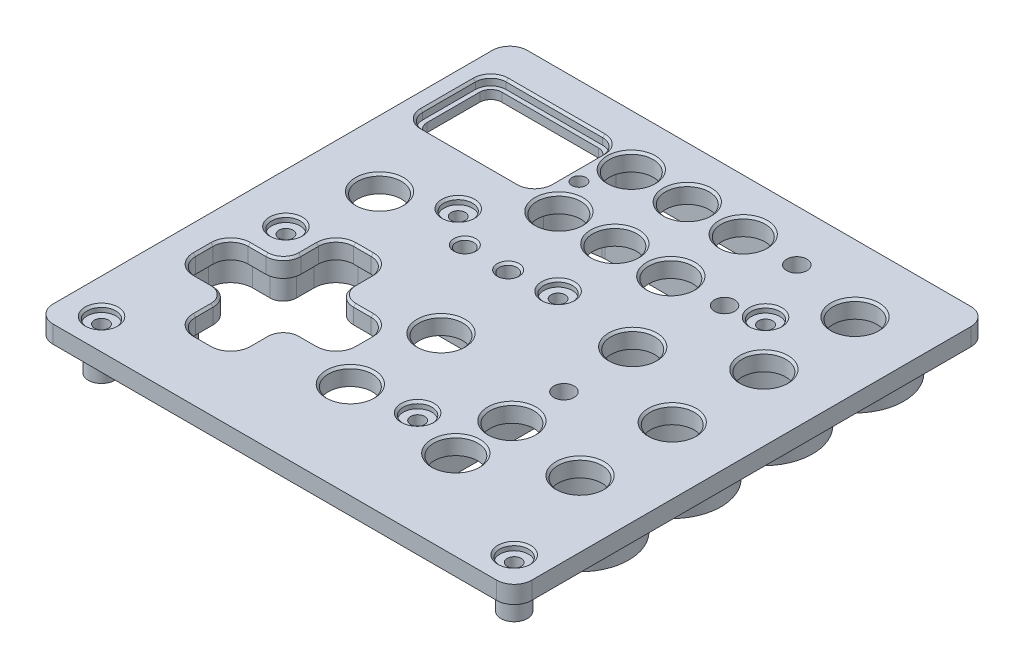
from build123d import *

# Parameters (mm, degrees)
BOSS_EXTRUDE1_DEPTH = 4
SKETCH3_R           = 5
SKETCH3_R_2         = 2
SKETCH3_R_3         = 2.3
CUT_EXTRUDE2_DEPTH  = 149.830769596
CUT_EXTRUDE8_DEPTH  = 2
CUT_EXTRUDE9_DEPTH  = 149.79044989
SKETCH13_R          = 10
SKETCH13_R_2        = 10.000000001
BOSS_EXTRUDE2_DEPTH = 7.1
CUT_EXTRUDE10_DEPTH = 1.5
SKETCH8_R           = 1.6
CUT_EXTRUDE7_DEPTH  = 150.190509009
FILLET1_R           = 4
FILLET2_R           = 4
FILLET5_R           = 4
SKETCH15_R          = 3.25
CUT_EXTRUDE11_DEPTH = 1.5
CHAMFER1_SIZE       = 0.5
FILLET10_R          = 3
SKETCH16_R          = 3
BOSS_EXTRUDE4_DEPTH = 7.1
SKETCH17_R          = 1.6
CUT_EXTRUDE12_DEPTH = 149.946325966
FILLET13_R          = 2


with BuildPart() as part:
    # Sketch1 → Boss-Extrude1 (new body)
    with BuildSketch(Plane(origin=(0, 0, 0), x_dir=(1, 0, 0), z_dir=(0, 1, 0))):
        with BuildLine():
            Line((32.631203293, 56.499998748), (133.631203293, 56.499998748))
            ThreePointArc((133.631203293, 56.499998748), (136.459630418, 55.328425873), (137.631203293, 52.499998748))
            Line((137.631203293, 52.499998748), (137.631203293, -47.500001252))
            ThreePointArc((137.631203293, -47.500001252), (136.459630418, -50.328428376), (133.631203293, -51.500001252))
            Line((133.631203293, -51.500001252), (32.631198922, -51.500001252))
            ThreePointArc((32.631198922, -51.500001252), (29.802771735, -50.328428314), (28.631198922, -47.500001077))
            Line((28.631198922, -47.500001077), (28.631203293, 52.499998923))
            ThreePointArc((28.631203293, 52.499998923), (29.80277623, 55.328425935), (32.631203293, 56.499998748))
        make_face()
    extrude(amount=BOSS_EXTRUDE1_DEPTH)

    # Sketch3 → Cut-Extrude2 (cut, through all)
    with BuildSketch(Plane(origin=(0, 4, 0), x_dir=(1, 0, 0), z_dir=(0, 1, 0))):
        with Locations(Location((122.506077718, 41.249953743, 0), (0, 0, 270))):
            Circle(SKETCH3_R)
        with Locations(Location((122.506076811, 20.499953743, 0), (0, 0, 270))):
            Circle(SKETCH3_R)
        with Locations(Location((122.506075899, -0.375046257, 0), (0, 0, 270))):
            Circle(SKETCH3_R)
        with Locations(Location((122.506074981, -21.375046257, 0), (0, 0, 270))):
            Circle(SKETCH3_R)
        with Locations(Location((103.95608732, -18.35004392, 0), (0, 0, 270))):
            Circle(SKETCH3_R)
        with Locations(Location((103.131076352, 9.99995459, 0), (0, 0, 270))):
            Circle(SKETCH3_R)
        with Locations(Location((78.581080094, -9.125044337, 0), (0, 0, 270))):
            Circle(SKETCH3_R)
        with Locations(Location((78.306321818, -29.499964216, 0), (0, 0, 270))):
            Circle(SKETCH3_R)
        with Locations(Location((43.631236649, 11.824870216, 0), (0, 0, 270))):
            Circle(SKETCH3_R)
        with Locations(Location((68.006161076, 28.300119395, 0), (0, 0, 270))):
            Circle(SKETCH3_R)
        with Locations(Location((80.756161076, 28.300118837, 0), (0, 0, 270))):
            Circle(SKETCH3_R)
        with Locations(Location((93.506168705, 28.30011828, 0), (0, 0, 270))):
            Circle(SKETCH3_R)
        with Locations(Location((93.506154167, 44.800125909, 0), (0, 0, 270))):
            Circle(SKETCH3_R)
        with Locations(Location((80.756161797, 44.800118837, 0), (0, 0, 270))):
            Circle(SKETCH3_R)
        with Locations(Location((68.006161797, 44.800119395, 0), (0, 0, 270))):
            Circle(SKETCH3_R)
        with Locations(Location((103.956071503, -31.125045446, 0), (0, 0, 270))):
            Circle(SKETCH3_R)
        with Locations(Location((63.881160319, 11.000124153, 0), (0, 0, 270))):
            Circle(SKETCH3_R_2)
        with Locations(Location((73.756244243, 10.999871951, 0), (0, 0, 270))):
            Circle(SKETCH3_R_2)
        with Locations(Location((105.634355846, 44.874916397, 0), (0, 0, 270))):
            Circle(SKETCH3_R_3)
        with Locations(Location((105.414739927, 28.624916408, 0), (0, 0, 270))):
            Circle(SKETCH3_R_3)
        with Locations(Location((104.131289505, -6.67345448, 0), (0, 0, 270))):
            Circle(SKETCH3_R_3)
        with BuildLine():
            Line((50.995103356, -1.449879142), (54.995103356, -1.449879142))
            ThreePointArc((54.995103356, -1.449879142), (57.82353048, -2.621452017), (58.995103356, -5.449879142))
            Line((58.995103356, -5.449879142), (58.995103356, -9.449879142))
            ThreePointArc((58.995103356, -9.449879142), (60.166676231, -12.278306267), (62.995103356, -13.449879142))
            Line((62.995103356, -13.449879142), (66.995103356, -13.449879142))
            ThreePointArc((66.995103356, -13.449879142), (69.82353048, -14.621452017), (70.995103356, -17.449879142))
            Line((70.995103356, -17.449879142), (70.995103356, -21.449879142))
            ThreePointArc((70.995103356, -21.449879142), (69.82353048, -24.278306267), (66.995103356, -25.449879142))
            Line((66.995103356, -25.449879142), (62.995103356, -25.449879142))
            ThreePointArc((62.995103356, -25.449879142), (60.166676231, -26.621452017), (58.995103356, -29.449879142))
            Line((58.995103356, -29.449879142), (58.995103356, -33.449879142))
            ThreePointArc((58.995103356, -33.449879142), (57.82353048, -36.278306267), (54.995103356, -37.449879142))
            Line((54.995103356, -37.449879142), (50.995103356, -37.449879142))
            ThreePointArc((50.995103356, -37.449879142), (48.166676231, -36.278306267), (46.995103356, -33.449879142))
            Line((46.995103356, -33.449879142), (46.995103356, -29.449879142))
            ThreePointArc((46.995103356, -29.449879142), (45.82353048, -26.621452017), (42.995103356, -25.449879142))
            Line((42.995103356, -25.449879142), (38.995103356, -25.449879142))
            ThreePointArc((38.995103356, -25.449879142), (36.166676231, -24.278306267), (34.995103356, -21.449879142))
            Line((34.995103356, -21.449879142), (34.995103356, -17.449879142))
            ThreePointArc((34.995103356, -17.449879142), (36.166676231, -14.621452017), (38.995103356, -13.449879142))
            Line((38.995103356, -13.449879142), (42.995103356, -13.449879142))
            ThreePointArc((42.995103356, -13.449879142), (45.82353048, -12.278306267), (46.995103356, -9.449879142))
            Line((46.995103356, -9.449879142), (46.995103356, -5.449879142))
            ThreePointArc((46.995103356, -5.449879142), (48.166676231, -2.621452017), (50.995103356, -1.449879142))
        make_face()
    extrude(amount=-CUT_EXTRUDE2_DEPTH, mode=Mode.SUBTRACT)

    # Sketch11 → Cut-Extrude8 (cut)
    with BuildSketch(Plane(origin=(0, 4, 0), x_dir=(1, 0, 0), z_dir=(0, 1, 0))):
        with BuildLine():
            Line((61.435461836, 44.861496233), (61.435461312, 32.861496233))
            ThreePointArc((61.435461312, 32.861496233), (60.410334938, 30.386622544), (57.935461159, 29.361496386))
            Line((57.935461159, 29.361496386), (35.935461159, 29.361497348))
            ThreePointArc((35.935461159, 29.361497348), (33.460587469, 30.386623722), (32.435461312, 32.861497501))
            Line((32.435461312, 32.861497501), (32.435461836, 44.861497501))
            ThreePointArc((32.435461836, 44.861497501), (33.46058821, 47.33637119), (35.935461989, 48.361497348))
            Line((35.935461989, 48.361497348), (57.935461989, 48.361496386))
            ThreePointArc((57.935461989, 48.361496386), (60.410335678, 47.336370012), (61.435461836, 44.861496233))
        make_face()
    extrude(amount=-CUT_EXTRUDE8_DEPTH, mode=Mode.SUBTRACT)

    # Sketch12 → Cut-Extrude9 (cut, through all)
    with BuildSketch(Plane(origin=(0, 2, 0), x_dir=(1, 0, 0), z_dir=(0, 1, 0))):
        with BuildLine():
            Line((57.935461945, 47.361496386), (35.935461945, 47.361497348))
            ThreePointArc((35.935461945, 47.361497348), (34.16769496, 46.629264378), (33.435461836, 44.861497457))
            Line((33.435461836, 44.861497457), (33.435461312, 32.861497457))
            ThreePointArc((33.435461312, 32.861497457), (34.167694281, 31.093730472), (35.935461202, 30.361497348))
            Line((35.935461202, 30.361497348), (57.935461202, 30.361496386))
            ThreePointArc((57.935461202, 30.361496386), (59.703228187, 31.093729356), (60.435461312, 32.861496277))
            Line((60.435461312, 32.861496277), (60.435461836, 44.861496277))
            ThreePointArc((60.435461836, 44.861496277), (59.703228866, 46.629263262), (57.935461945, 47.361496386))
        make_face()
    extrude(amount=-CUT_EXTRUDE9_DEPTH, mode=Mode.SUBTRACT)

    # Sketch13 → Boss-Extrude2 (add)
    # profile 1 of 2: a face of its own
    with BuildSketch(Plane.XZ):
        with BuildLine():
            Line((112.381311503, -52.499998748), (112.381311503, -45.832521393))
            ThreePointArc((112.381311503, -45.832521393), (128.710531391, -50.456591469), (130.601426663, -33.590947062))
            ThreePointArc((130.601426663, -33.590947062), (129.512041425, -30.847168509), (130.601426423, -28.103389861))
            ThreePointArc((130.601426423, -28.103389861), (133.631268001, -20.44050639), (130.557858117, -12.794993014))
            ThreePointArc((130.557858117, -12.794993014), (129.452808289, -10.034669017), (130.557889384, -7.274357538))
            ThreePointArc((130.557889384, -7.274357538), (133.631472718, 0.435028029), (130.513728685, 8.126660657))
            ThreePointArc((130.513728685, 8.126660657), (129.392770218, 10.903491507), (130.513646115, 13.680355688))
            ThreePointArc((130.513646115, 13.680355688), (129.265062352, 30.239913396), (112.956076474, 27.11023409))
            Line((112.956076474, 27.11023409), (112.956071503, 31.125045446))
            ThreePointArc((112.956071503, 31.125045446), (103.956071503, 40.125045446), (94.956071503, 31.125045446))
            Line((94.956071503, 31.125045446), (94.956102156, 6.367721726))
            ThreePointArc((94.956102156, 6.367721726), (95.194943617, 4.308088057), (95.898790175, 2.35777113))
            ThreePointArc((95.898790175, 2.35777113), (96.269036168, -0.046874941), (95.177457934, -2.221239625))
            ThreePointArc((95.177457934, -2.221239625), (92.815567647, -5.833573353), (92.006188808, -10.072958519))
            Line((92.006188808, -10.072958519), (92.006188808, -16.499953743))
            ThreePointArc((92.006188808, -16.499953743), (90.834615932, -19.328380868), (88.006188808, -20.499953743))
            Line((88.006188808, -20.499953743), (61.381311503, -20.499953743))
            Line((61.381311503, -20.499953743), (61.381311503, -21.499998748))
            Line((61.381311503, -21.499998748), (61.381311503, -52.499998748))
            Line((61.381311503, -52.499998748), (112.381311503, -52.499998748))
        make_face()
        with Locations(Location((122.506077718, -41.249953743, 0), (0, 0, 270))):
            Circle(SKETCH13_R, mode=Mode.SUBTRACT)
        with Locations(Location((122.50607681, -20.499953743, 0), (0, 0, 270))):
            Circle(SKETCH13_R_2, mode=Mode.SUBTRACT)
        with Locations(Location((122.506075865, 0.403127197, 0), (0, 0, 270))):
            Circle(SKETCH13_R, mode=Mode.SUBTRACT)
        with Locations(Location((103.131076352, -9.99995459, 0), (0, 0, 270))):
            Circle(SKETCH13_R, mode=Mode.SUBTRACT)
        with Locations(Location((122.506074981, 21.375046257, 0), (0, 0, 270))):
            Circle(SKETCH13_R, mode=Mode.SUBTRACT)
        with BuildLine():
            Line((68.006161076, -22.300121067), (106.506161076, -22.300121067))
            ThreePointArc((106.506161076, -22.300121067), (109.3345882, -23.471693942), (110.506161076, -26.300121067))
            Line((110.506161076, -26.300121067), (110.506161076, -34.300117723))
            Line((110.506161076, -34.300117723), (110.506161076, -35.300117723))
            Line((110.506161076, -35.300117723), (71.525951312, -35.300117723))
            ThreePointArc((71.525951312, -35.300117723), (71.217230855, -35.288186388), (70.910352122, -35.252463562))
            Line((70.910352122, -35.252463562), (68.271969785, -34.841521277))
            ThreePointArc((68.271969785, -34.841521277), (68.036326851, -34.811953853), (67.799344527, -34.796423127))
            ThreePointArc((67.799344527, -34.796423127), (64.366254104, -33.511828549), (62.393936762, -30.42212672))
            ThreePointArc((62.393936762, -30.42212672), (63.069968172, -24.889259496), (68.006161076, -22.300121067))
        make_face(mode=Mode.SUBTRACT)
        with BuildLine():
            Line((68.006161797, -51.300119395), (106.506161076, -51.300119395))
            ThreePointArc((106.506161076, -51.300119395), (109.3345882, -50.128546519), (110.506161076, -47.300119395))
            Line((110.506161076, -47.300119395), (110.506161076, -42.800119395))
            ThreePointArc((110.506161076, -42.800119395), (109.3345882, -39.97169227), (106.506161076, -38.800119395))
            Line((106.506161076, -38.800119395), (68.006161797, -38.800119395))
            ThreePointArc((68.006161797, -38.800119395), (63.069967049, -41.389257126), (62.393934992, -46.92212559))
            ThreePointArc((62.393934992, -46.92212559), (64.447232202, -50.076170733), (68.006161797, -51.300119395))
        make_face(mode=Mode.SUBTRACT)
        with BuildLine():
            Line((96.956071503, 31.125045446), (96.956102156, 6.367724202))
            ThreePointArc((96.956102156, 6.367724202), (97.147762585, 4.740913736), (97.712248525, 3.203187611))
            ThreePointArc((97.712248525, 3.203187611), (99.399384885, 1.481244018), (101.76965802, 1.041557652))
            ThreePointArc((101.76965802, 1.041557652), (103.691136155, 1.111066311), (105.595885547, 0.848693625))
            ThreePointArc((105.595885547, 0.848693625), (107.998357837, 1.047805981), (109.850094686, 2.591369869))
            ThreePointArc((109.850094686, 2.591369869), (110.673912354, 4.400231853), (110.956102156, 6.367724202))
            Line((110.956102156, 6.367724202), (110.956071503, 31.125045446))
            ThreePointArc((110.956071503, 31.125045446), (103.956071503, 38.125045446), (96.956071503, 31.125045446))
        make_face(mode=Mode.SUBTRACT)
    # profile 2 of 2: a face of its own
    with BuildSketch(Plane.XZ):
        with BuildLine():
            Line((49.095103356, -3.450120858), (56.695103356, -3.450120858))
            Line((56.695103356, -3.450120858), (60.380567103, -3.195239903))
            Line((60.380567103, -3.195239903), (80.135371674, -3.195239903))
            ThreePointArc((80.135371674, -3.195239903), (80.688306529, -3.156838449), (81.230624634, -3.042371425))
            Line((81.230624634, -3.042371425), (84.09525296, -2.226830642))
            ThreePointArc((84.09525296, -2.226830642), (86.192257183, -0.78998833), (87, 1.620300881))
            Line((87, 1.620300881), (87, 41.214767576))
            Line((87, 41.214767576), (81.139458109, 41.214767576))
            Line((81.139458109, 41.214767576), (80.945291109, 41.214767576))
            ThreePointArc((80.945291109, 41.214767576), (79.995007405, 41.100248354), (79.099136577, 40.763248017))
            ThreePointArc((79.099136577, 40.763248017), (76.929258511, 40.216325907), (74.744832485, 40.701895217))
            ThreePointArc((74.744832485, 40.701895217), (73.89483606, 41.001292059), (72.999388249, 41.102808608))
            Line((72.999388249, 41.102808608), (60.776836678, 41.102808608))
            ThreePointArc((60.776836678, 41.102808608), (60.262195435, 41.237060059), (59.769914982, 41.438403092))
            ThreePointArc((59.769914982, 41.438403092), (58.273129394, 41.969691003), (56.695103356, 42.149879142))
            ThreePointArc((56.695103356, 42.149879142), (56.183298772, 42.117001029), (55.679907773, 42.018907176))
            ThreePointArc((55.679907773, 42.018907176), (54.274615171, 41.656637939), (52.841714564, 41.88659913))
            ThreePointArc((52.841714564, 41.88659913), (52.140150751, 42.083508506), (51.414506193, 42.149879142))
            Line((51.414506193, 42.149879142), (49.095103356, 42.149879142))
            ThreePointArc((49.095103356, 42.149879142), (44.145355887, 40.09962661), (42.095103356, 35.149879142))
            Line((42.095103356, 35.149879142), (42.095103356, 31.149879142))
            ThreePointArc((42.095103356, 31.149879142), (41.802210137, 30.442772361), (41.095103356, 30.149879142))
            Line((41.095103356, 30.149879142), (37.095103356, 30.149879142))
            ThreePointArc((37.095103356, 30.149879142), (32.145355887, 28.09962661), (30.095103356, 23.149879142))
            Line((30.095103356, 23.149879142), (30.095103356, 15.549879142))
            ThreePointArc((30.095103356, 15.549879142), (32.145355887, 10.600131674), (37.095103356, 8.549879142))
            Line((37.095103356, 8.549879142), (41.095103356, 8.549879142))
            ThreePointArc((41.095103356, 8.549879142), (41.802210137, 8.256985923), (42.095103356, 7.549879142))
            Line((42.095103356, 7.549879142), (42.095103356, 3.549879142))
            ThreePointArc((42.095103356, 3.549879142), (44.145355887, -1.399868326), (49.095103356, -3.450120858))
        make_face()
        with BuildLine():
            Line((78.425576037, -1.195239903), (60.311491151, -1.195239903))
            Line((60.311491151, -1.195239903), (56.626027404, -1.450120858))
            Line((56.626027404, -1.450120858), (49.095103356, -1.450120858))
            ThreePointArc((49.095103356, -1.450120858), (45.55956945, 0.014345236), (44.095103356, 3.549879142))
            Line((44.095103356, 3.549879142), (44.095103356, 7.549879142))
            ThreePointArc((44.095103356, 7.549879142), (43.216423699, 9.671199486), (41.095103356, 10.549879142))
            Line((41.095103356, 10.549879142), (37.095103356, 10.549879142))
            ThreePointArc((37.095103356, 10.549879142), (33.55956945, 12.014345236), (32.095103356, 15.549879142))
            Line((32.095103356, 15.549879142), (32.095103356, 23.149879142))
            ThreePointArc((32.095103356, 23.149879142), (33.55956945, 26.685413048), (37.095103356, 28.149879142))
            Line((37.095103356, 28.149879142), (41.095103356, 28.149879142))
            ThreePointArc((41.095103356, 28.149879142), (43.216423699, 29.028558799), (44.095103356, 31.149879142))
            Line((44.095103356, 31.149879142), (44.095103356, 35.149879142))
            ThreePointArc((44.095103356, 35.149879142), (45.55956945, 38.685413048), (49.095103356, 40.149879142))
            Line((49.095103356, 40.149879142), (56.695103356, 40.149879142))
            ThreePointArc((56.695103356, 40.149879142), (57.891035416, 40.004747473), (59.01754043, 39.577777745))
            ThreePointArc((59.01754043, 39.577777745), (59.557201024, 39.343575219), (60.125376572, 39.191059886))
            Line((60.125376572, 39.191059886), (81.788517975, 39.191059886))
            ThreePointArc((81.788517975, 39.191059886), (85.192384454, 39.312475403), (85, 35.911881786))
            Line((85, 35.911881786), (85, 4.600131674))
            Line((85, 4.600131674), (85, 4.318345948))
            ThreePointArc((85, 4.318345948), (85.04254454, 3.736498649), (85.16927314, 3.167028563))
            ThreePointArc((85.16927314, 3.167028563), (85.011243619, 1.636499443), (83.813095291, 0.671132519))
            ThreePointArc((83.813095291, 0.671132519), (83.097586719, 0.385497491), (82.450108194, -0.032008732))
            Line((82.450108194, -0.032008732), (82.308737711, -0.143820506))
            ThreePointArc((82.308737711, -0.143820506), (81.39061527, -0.688374311), (80.361162333, -0.970711547))
            Line((80.361162333, -0.970711547), (78.959358919, -1.159464396))
            ThreePointArc((78.959358919, -1.159464396), (78.693066248, -1.186286004), (78.425576037, -1.195239903))
        make_face(mode=Mode.SUBTRACT)
    extrude(amount=BOSS_EXTRUDE2_DEPTH)

    # Sketch14 → Cut-Extrude10 (cut)
    with BuildSketch(Plane.XZ.offset(7.1)):
        Polygon((110.956071503, 31.125045446), (110.956071503, 40.214356116), (106.956071503, 40.214356116), (96.956071503, 40.214356116), (96.956071503, 31.125045446), (106.956071503, 31.125045446), align=None)
    extrude(amount=-CUT_EXTRUDE10_DEPTH, mode=Mode.SUBTRACT)

    # Sketch8 → Cut-Extrude7 (cut, through all)
    with BuildSketch(Plane(origin=(0, 4, 0), x_dir=(-1, 0, 0), z_dir=(0, -1, 0))):
        with Locations(Location((-36.631198133, -44.500002521, 0), (0, 0, 270))):
            Circle(SKETCH8_R)
        with Locations(Location((-91.631200636, -27.500003365, 0), (0, 0, 270))):
            Circle(SKETCH8_R)
        with Locations(Location((-39.881200947, -5.750001423, 0), (0, 0, 270))):
            Circle(SKETCH8_R)
        with Locations(Location((-56.006201457, 17.374998612, 0), (0, 0, 270))):
            Circle(SKETCH8_R)
        with Locations(Location((-64.381202053, 36.499996826, 0), (0, 0, 90))):
            Circle(SKETCH8_R)
        with Locations(Location((-83.631200604, 12.499995724, 0), (0, 0, 270))):
            Circle(SKETCH8_R)
        with Locations(Location((-112.381202333, 30.999995568, 0), (0, 0, 90))):
            Circle(SKETCH8_R)
        with Locations(Location((-130.631198093, -44.50000663, 0), (0, 0, 270))):
            Circle(SKETCH8_R)
    extrude(amount=CUT_EXTRUDE7_DEPTH, mode=Mode.SUBTRACT)

    # Fillet1
    fillet1_edges = [part.edges().sort_by_distance(p)[0] for p in [
        (110.506161076, -3.55, -35.300117723),
    ]]
    fillet(fillet1_edges, radius=FILLET1_R)

    # Fillet2
    fillet2_edges = [part.edges().sort_by_distance(p)[0] for p in [
        (112.956076474, -3.55, 27.11023409),
    ]]
    fillet(fillet2_edges, radius=FILLET2_R)

    # Fillet5
    # the kernel refuses this fillet: 4 mm, written as the material it adds along each edge
    with BuildSketch(Plane(origin=(112.381311503, 0, -45.832521393), x_dir=(0.6930659969865375, 0, -0.7208741386823755), z_dir=(0, -1, 0))) as fillet5_piece_1:
        with BuildLine():
            CenterArc((8.715510797, -3.773094674), FILLET5_R, 109.391199088, 82.847023413)
            Line((4.806411996, -4.621001841), (4.72823002, -4.637959984))
            ThreePointArc((4.72823002, -4.637959984), (2.347760718, -2.368170852), (-0.05544528, -0.057669931))
            Line((-0.05544528, -0.057669931), (0.0265613, 0.075461893))
            ThreePointArc((0.0265613, 0.075461893), (3.69372291, -0.551087648), (7.36088452, 0.075461893))
            Line((7.36088452, 0.075461893), (7.387445819, 0))
        make_face()
    extrude(amount=7.1)

    # Sketch15 → Cut-Extrude11 (cut)
    with BuildSketch(Plane(origin=(0, 4, 0), x_dir=(1, 0, 0), z_dir=(0, 1, 0))):
        with Locations(Location((56.006201457, 17.374998612, 0), (0, 0, 270))):
            Circle(SKETCH15_R)
        with Locations(Location((39.881200947, -5.750001423, 0), (0, 0, 270))):
            Circle(SKETCH15_R)
        with Locations(Location((36.631198133, -44.500002521, 0), (0, 0, 270))):
            Circle(SKETCH15_R)
        with Locations(Location((91.631200636, -27.500003365, 0), (0, 0, 270))):
            Circle(SKETCH15_R)
        with Locations(Location((130.631198093, -44.50000663, 0), (0, 0, 270))):
            Circle(SKETCH15_R)
        with Locations(Location((112.381202333, 30.999995568, 0), (0, 0, 270))):
            Circle(SKETCH15_R)
        with Locations(Location((83.631200604, 12.499995724, 0), (0, 0, 270))):
            Circle(SKETCH15_R)
    extrude(amount=-CUT_EXTRUDE11_DEPTH, mode=Mode.SUBTRACT)

    # Chamfer1
    chamfer1_edges = [part.edges().sort_by_distance(p)[0] for p in [
        (60.166676231, 4, 26.621452017),
        (64.995103356, 4, 25.449879142),
        (69.82353048, 4, 24.278306267),
        (70.995103356, 4, 19.449879142),
        (69.82353048, 4, 14.621452017),
        (64.995103356, 4, 13.449879142),
        (60.166676231, 4, 12.278306267),
        (58.995103356, 4, 7.449879142),
        (57.82353048, 4, 2.621452017),
        (52.995103356, 4, 1.449879142),
        (48.166676231, 4, 2.621452017),
        (46.995103356, 4, 7.449879142),
        (45.82353048, 4, 12.278306267),
        (40.995103356, 4, 13.449879142),
        (36.166676231, 4, 14.621452017),
        (34.995103356, 4, 19.449879142),
        (36.166676231, 4, 24.278306267),
        (40.995103356, 4, 25.449879142),
        (45.82353048, 4, 26.621452017),
        (46.995103356, 4, 31.449879142),
        (48.166676231, 4, 36.278306267),
        (52.995103356, 4, 37.449879142),
        (57.82353048, 4, 36.278306267),
        (58.995103356, 4, 31.449879142),
        (73.756244243, 4, -12.999871951),
        (122.506076811, 4, -25.499953743),
        (60.410335678, 4, -47.336370012),
        (46.935461989, 4, -48.361496867),
        (33.46058821, 4, -47.33637119),
        (32.435461574, 4, -38.861497501),
        (33.460587469, 4, -30.386623722),
        (46.935461159, 4, -29.361496867),
        (60.410334938, 4, -30.386622544),
        (61.435461574, 4, -38.861496233),
        (83.631200604, 4, -15.749995724),
        (112.381202333, 4, -34.249995568),
        (130.631198093, 4, 41.25000663),
        (91.631200636, 4, 24.250003365),
        (36.631198133, 4, 41.250002521),
        (39.881200947, 4, 2.500001423),
        (56.006201457, 4, -20.624998612),
        (68.006161076, 4, -33.300119395),
        (80.756161076, 4, -33.300118837),
        (93.506168705, 4, -33.30011828),
        (93.506154167, 4, -49.800125909),
        (80.756161797, 4, -49.800118837),
        (68.006161797, 4, -49.800119395),
        (103.956071503, 4, 26.125045446),
        (63.881160319, 4, -13.000124153),
        (122.506075899, 4, -4.624953743),
        (122.506077718, 4, -46.249953743),
        (122.506074981, 4, 16.375046257),
        (103.95608732, 4, 13.35004392),
        (43.631236649, 4, -16.824870216),
        (78.306321818, 4, 24.499964216),
        (78.581080094, 4, 4.125044337),
        (103.131076352, 4, -14.99995459),
    ]]
    chamfer(chamfer1_edges, length=CHAMFER1_SIZE)

    # Fillet10
    fillet10_edges = [part.edges().sort_by_distance(p)[0] for p in [
        (87, -3.55, 41.214767576),
    ]]
    fillet(fillet10_edges, radius=FILLET10_R)

    # Sketch16 → Boss-Extrude4 (add)
    with BuildSketch(Plane.XZ):
        with Locations(Location((36.631198133, 44.500002521, 0), (0, 0, 90))):
            Circle(SKETCH16_R)
        with Locations(Location((56.006201457, -17.374998612, 0), (0, 0, 90))):
            Circle(SKETCH16_R)
        with Locations(Location((130.631198093, 44.50000663, 0), (0, 0, 90))):
            Circle(SKETCH16_R)
        with Locations(Location((83.631200604, -12.499995724, 0), (0, 0, 90))):
            Circle(SKETCH16_R)
        with BuildLine():
            Line((40.958551753, 8.549879142), (41.095103356, 8.549879142))
            ThreePointArc((41.095103356, 8.549879142), (41.702452242, 8.34431437), (42.060102056, 7.812133804))
            ThreePointArc((42.060102056, 7.812133804), (38.211811483, 3.257384562), (40.958551753, 8.549879142))
        make_face()
        Polygon((87, 24.500003365), (87, 30.500003365), (91.631200636, 30.500003365), (94.956072277, 30.500003365), (94.956079706, 24.500003365), (91.631200636, 24.500003365), align=None)
    extrude(amount=BOSS_EXTRUDE4_DEPTH)

    # Sketch17 → Cut-Extrude12 (cut, through all)
    with BuildSketch(Plane(origin=(0, 0, 0), x_dir=(1, 0, 0), z_dir=(0, 1, 0))):
        with Locations(Location((36.631198133, -44.500002521, 0), (0, 0, 270))):
            Circle(SKETCH17_R)
        with Locations(Location((39.881200947, -5.750001423, 0), (0, 0, 270))):
            Circle(SKETCH17_R)
        with Locations(Location((56.006201457, 17.374998612, 0), (0, 0, 270))):
            Circle(SKETCH17_R)
        with Locations(Location((83.631200604, 12.499995724, 0), (0, 0, 270))):
            Circle(SKETCH17_R)
        with Locations(Location((91.631200636, -27.500003365, 0), (0, 0, 270))):
            Circle(SKETCH17_R)
        with Locations(Location((130.631198093, -44.50000663, 0), (0, 0, 270))):
            Circle(SKETCH17_R)
    extrude(amount=-CUT_EXTRUDE12_DEPTH, mode=Mode.SUBTRACT)

    # Fillet13
    fillet13_edges = [part.edges().sort_by_distance(p)[0] for p in [
        (94.956072277, -3.55, 30.500003365),
        (87, -3.55, 30.500003365),
        (94.956079706, -3.55, 24.500003365),
        (87, -3.55, 24.500003365),
        (38.803850141, -3.55, 8.549879142),
        (42.095103356, -3.55, 3.725492563),
        (61.381311503, -3.55, -20.499953743),
        (112.381311503, -3.55, -52.499998748),
        (61.381311503, -3.55, -52.499998748),
    ]]
    fillet(fillet13_edges, radius=FILLET13_R)


solid = part.part
